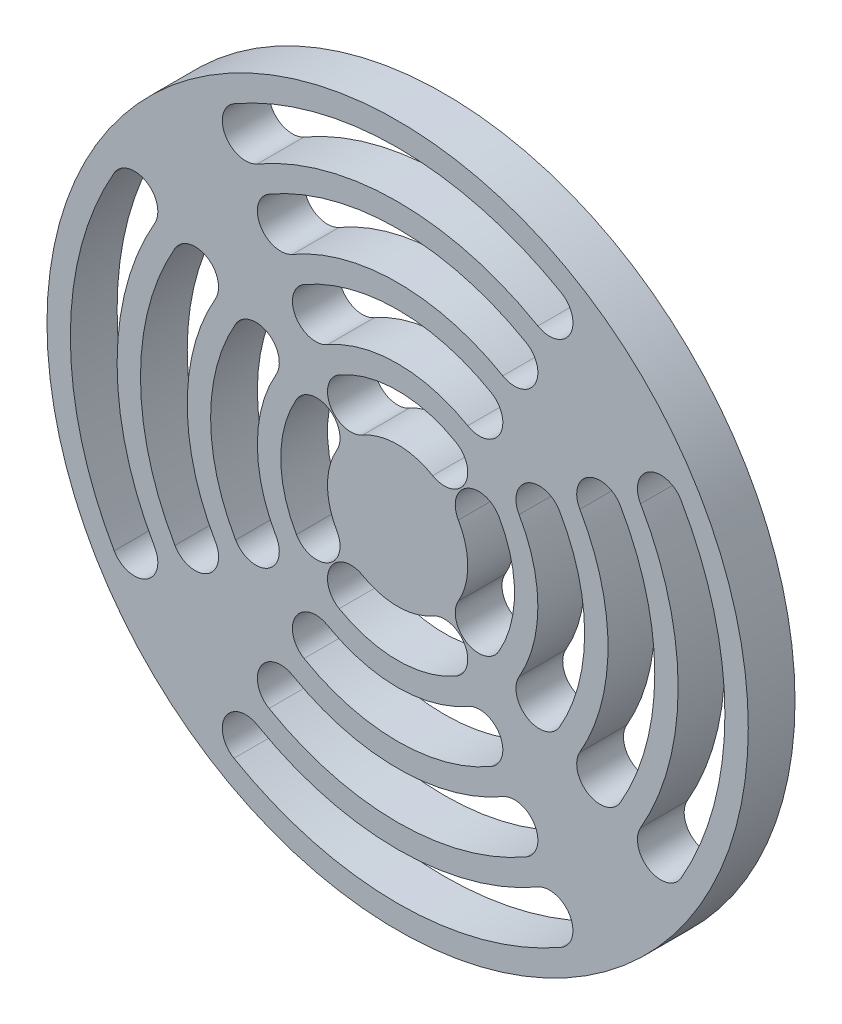
from build123d import *

# Parameters (mm, degrees)
SKETCH1_R           = 75
BOSS_EXTRUDE1_DEPTH = 10
CUT_EXTRUDE1_DEPTH  = 10
LPATTERN1_DEPTH     = 10
CIRPATTERN1_COUNT   = 4


# Read off the part's stored shape, not the designer's step: LPattern1
with BuildPart() as part:
    # Sketch1 → Boss-Extrude1 (new body)
    with BuildSketch(Plane.XY):
        Circle(SKETCH1_R)
    extrude(amount=BOSS_EXTRUDE1_DEPTH)

    # Sketch2 → Cut-Extrude1 (cut)
    with BuildSketch(Plane.XY.offset(10)):
        with BuildLine():
            ThreePointArc((35, 60.621778265), (0, 70), (-35, 60.621778265))
            ThreePointArc((-35, 60.621778265), (-36.830127019, 53.791651246), (-30, 51.961524227))
            ThreePointArc((-30, 51.961524227), (0, 60), (30, 51.961524227))
            ThreePointArc((30, 51.961524227), (36.830127019, 53.791651246), (35, 60.621778265))
        make_face()
    cut_extrude1 = extrude(amount=-CUT_EXTRUDE1_DEPTH, mode=Mode.SUBTRACT)

    # LPattern1 outline → LPattern1 (cut)
    with BuildSketch(Plane.XY):
        with BuildLine():
            ThreePointArc((-22.5, 38.97114317), (0, 45), (22.5, 38.97114317))
            ThreePointArc((22.5, 38.97114317), (29.330127019, 40.801270189), (27.5, 47.631397208))
            ThreePointArc((27.5, 47.631397208), (0, 55), (-27.5, 47.631397208))
            ThreePointArc((-27.5, 47.631397208), (-29.330127019, 40.801270189), (-22.5, 38.97114317))
        make_face()
        with BuildLine():
            ThreePointArc((-7.5, 12.990381057), (0, 15), (7.5, 12.990381057))
            ThreePointArc((7.5, 12.990381057), (14.330127019, 14.820508076), (12.5, 21.650635095))
            ThreePointArc((12.5, 21.650635095), (0, 25), (-12.5, 21.650635095))
            ThreePointArc((-12.5, 21.650635095), (-14.330127019, 14.820508076), (-7.5, 12.990381057))
        make_face()
        with BuildLine():
            ThreePointArc((-15, 25.980762114), (0, 30), (15, 25.980762114))
            ThreePointArc((15, 25.980762114), (21.830127019, 27.810889132), (20, 34.641016151))
            ThreePointArc((20, 34.641016151), (0, 40), (-20, 34.641016151))
            ThreePointArc((-20, 34.641016151), (-21.830127019, 27.810889132), (-15, 25.980762114))
        make_face()
    lpattern1 = extrude(amount=LPATTERN1_DEPTH, mode=Mode.SUBTRACT)

    # CirPattern1: Cut-Extrude1, LPattern1 ×4 about axis
    cirpattern1_axis = Axis((0, 0, 0), (0, 0, 1))
    add([cut_extrude1.rotate(cirpattern1_axis, i * 360 / CIRPATTERN1_COUNT) for i in range(1, CIRPATTERN1_COUNT)], mode=Mode.SUBTRACT)
    add([lpattern1.rotate(cirpattern1_axis, i * 360 / CIRPATTERN1_COUNT) for i in range(1, CIRPATTERN1_COUNT)], mode=Mode.SUBTRACT)


solid = part.part
